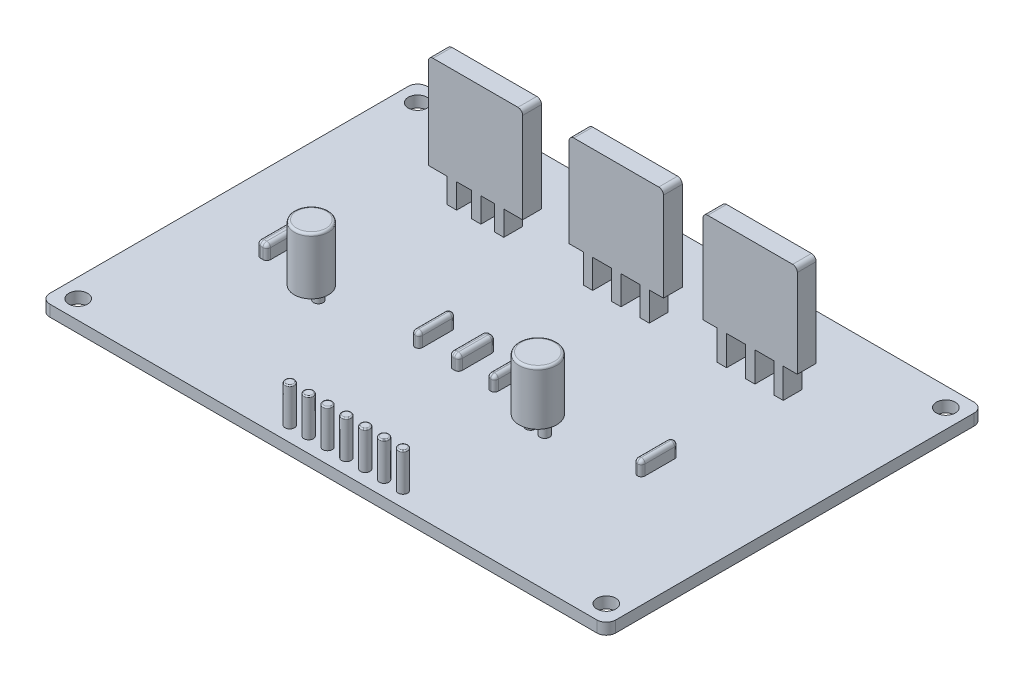
from build123d import *

# Parameters (mm, degrees)
SKETCH2_W            = 60
SKETCH2_H            = 40
BOSS_EXTRUDE1_DEPTH  = 1.2
SKETCH3_R            = 1
CUT_EXTRUDE1_DEPTH   = 2
SKETCH4_W            = 10
SKETCH4_H            = 2
BOSS_EXTRUDE2_DEPTH  = 12.69574079
SKETCH5_W            = 2
SKETCH5_H            = 2.607216684
SKETCH5_W_2          = 1.574700475
SKETCH5_W_3          = 1.425299525
CUT_EXTRUDE2_DEPTH   = 3
SKETCH6_W            = 10
SKETCH6_H            = 2
BOSS_EXTRUDE3_DEPTH  = 13
SKETCH7_W            = 1.5
SKETCH7_H            = 3.045870759
SKETCH7_W_2          = 2
CUT_EXTRUDE3_DEPTH   = 3
SKETCH8_W            = 1.5
SKETCH8_H            = 3.153243881
SKETCH8_W_2          = 2
CUT_EXTRUDE4_DEPTH   = 3
SKETCH9_R            = 0.5
BOSS_EXTRUDE5_DEPTH  = 1
SKETCH10_R           = 1.814545967
BOSS_EXTRUDE6_DEPTH  = 6
SKETCH11_R           = 0.5
BOSS_EXTRUDE7_DEPTH  = 1.5
SKETCH12_R           = 2
BOSS_EXTRUDE9_DEPTH  = 5.7
SKETCH13_R           = 0.5
BOSS_EXTRUDE10_DEPTH = 4
FILLET1_R            = 1
FILLET2_R            = 0.5
FILLET3_R            = 0.25
FILLET4_R            = 0.125
SKETCH14_W           = 0.800980935
SKETCH14_H           = 3.924518692
SKETCH14_W_2         = 1.006338104
SKETCH14_W_3         = 0.836911108
SKETCH14_W_4         = 0.805722202
SKETCH14_W_5         = 1.080198416
BOSS_EXTRUDE11_DEPTH = 1.5
FILLET5_R            = 0.4
FILLET6_R            = 0.4


with BuildPart() as part:
    # Sketch2 → Boss-Extrude1 (new body)
    with BuildSketch(Plane(origin=(0, 0, 0), x_dir=(1, 0, 0), z_dir=(0, 1, 0))):
        Rectangle(SKETCH2_W, SKETCH2_H)
    extrude(amount=BOSS_EXTRUDE1_DEPTH)

    # Sketch3 → Cut-Extrude1 (cut)
    with BuildSketch(Plane(origin=(0, 1.2, 0), x_dir=(1, 0, 0), z_dir=(0, 1, 0))):
        with Locations((-28, -18)):
            Circle(SKETCH3_R)
        with Locations((-28, 18)):
            Circle(SKETCH3_R)
        with Locations((28, 18)):
            Circle(SKETCH3_R)
        with Locations((28, -18)):
            Circle(SKETCH3_R)
    extrude(amount=-CUT_EXTRUDE1_DEPTH, mode=Mode.SUBTRACT)

    # Sketch4 → Boss-Extrude2 (add)
    with BuildSketch(Plane(origin=(0, 1.2, 0), x_dir=(1, 0, 0), z_dir=(0, 1, 0))):
        with Locations((-14.064988864, 11.195743951)):
            Rectangle(SKETCH4_W, SKETCH4_H)
    extrude(amount=BOSS_EXTRUDE2_DEPTH)

    # Sketch5 → Cut-Extrude2 (cut)
    with BuildSketch(Plane.XY.offset(-10.195743951)):
        with Locations((-18.064988864, 2.503608342)):
            Rectangle(SKETCH5_W, SKETCH5_H)
        with Locations((-10.064988864, 2.503608342)):
            Rectangle(SKETCH5_W, SKETCH5_H)
        with Locations((-15.277638626, 2.503608342)):
            Rectangle(SKETCH5_W_2, SKETCH5_H)
        with Locations((-12.777638626, 2.503608342)):
            Rectangle(SKETCH5_W_3, SKETCH5_H)
    extrude(amount=-CUT_EXTRUDE2_DEPTH, mode=Mode.SUBTRACT)

    # Sketch6 → Boss-Extrude3 (add)
    with BuildSketch(Plane(origin=(0, 1.2, 0), x_dir=(1, 0, 0), z_dir=(0, 1, 0))):
        with Locations((1.024873768, 11.033307635)):
            Rectangle(SKETCH6_W, SKETCH6_H)
        with Locations((15.221753168, 11.033307635)):
            Rectangle(SKETCH6_W, SKETCH6_H)
    extrude(amount=BOSS_EXTRUDE3_DEPTH)

    # Sketch7 → Cut-Extrude3 (cut)
    with BuildSketch(Plane.XY.offset(-10.033307635)):
        with Locations((-3.225126232, 2.72293538)):
            Rectangle(SKETCH7_W, SKETCH7_H)
        with Locations((5.274873768, 2.72293538)):
            Rectangle(SKETCH7_W, SKETCH7_H)
        with Locations((-0.475126232, 2.72293538)):
            Rectangle(SKETCH7_W_2, SKETCH7_H)
        with Locations((2.524873768, 2.72293538)):
            Rectangle(SKETCH7_W_2, SKETCH7_H)
    extrude(amount=-CUT_EXTRUDE3_DEPTH, mode=Mode.SUBTRACT)

    # Sketch8 → Cut-Extrude4 (cut)
    with BuildSketch(Plane.XY.offset(-10.033307635)):
        with Locations((10.971753168, 2.776621941)):
            Rectangle(SKETCH8_W, SKETCH8_H)
        with Locations((19.471753168, 2.776621941)):
            Rectangle(SKETCH8_W, SKETCH8_H)
        with Locations((16.721753168, 2.776621941)):
            Rectangle(SKETCH8_W_2, SKETCH8_H)
        with Locations((13.721753168, 2.776621941)):
            Rectangle(SKETCH8_W_2, SKETCH8_H)
    extrude(amount=-CUT_EXTRUDE4_DEPTH, mode=Mode.SUBTRACT)

    # Sketch9 → Boss-Extrude5 (add)
    with BuildSketch(Plane(origin=(0, 1.2, 0), x_dir=(1, 0, 0), z_dir=(0, 1, 0))):
        with Locations((-16.64570554, -5.388190515)):
            Circle(SKETCH9_R)
        with Locations((-15.14570554, -5.388190515)):
            Circle(SKETCH9_R)
    extrude(amount=BOSS_EXTRUDE5_DEPTH)

    # Sketch10 → Boss-Extrude6 (add)
    with BuildSketch(Plane(origin=(0, 2.2, 0), x_dir=(1, 0, 0), z_dir=(0, 1, 0))):
        with Locations((-15.895664673, -5.377177987)):
            Circle(SKETCH10_R)
    extrude(amount=BOSS_EXTRUDE6_DEPTH)

    # Sketch11 → Boss-Extrude7 (add)
    with BuildSketch(Plane(origin=(0, 1.2, 0), x_dir=(1, 0, 0), z_dir=(0, 1, 0))):
        with Locations((7.719899119, -5.747410751)):
            Circle(SKETCH11_R)
        with Locations((9.219899119, -5.747410751)):
            Circle(SKETCH11_R)
    extrude(amount=BOSS_EXTRUDE7_DEPTH)

    # Sketch12 → Boss-Extrude9 (add)
    with BuildSketch(Plane(origin=(0, 2.7, 0), x_dir=(1, 0, 0), z_dir=(0, 1, 0))):
        with Locations((8.453559057, -5.714453729)):
            Circle(SKETCH12_R)
    extrude(amount=BOSS_EXTRUDE9_DEPTH)

    # Sketch13 → Boss-Extrude10 (add)
    with BuildSketch(Plane(origin=(0, 1.2, 0), x_dir=(1, 0, 0), z_dir=(0, 1, 0))):
        with Locations((-5.169756881, -18.391564272)):
            Circle(SKETCH13_R)
        with Locations((-3.169756881, -18.391564272)):
            Circle(SKETCH13_R)
        with Locations((-1.169756881, -18.391564272)):
            Circle(SKETCH13_R)
        with Locations((0.830243119, -18.391564272)):
            Circle(SKETCH13_R)
        with Locations((2.830243119, -18.391564272)):
            Circle(SKETCH13_R)
        with Locations((4.830243119, -18.391564272)):
            Circle(SKETCH13_R)
        with Locations((6.830243119, -18.391564272)):
            Circle(SKETCH13_R)
    extrude(amount=BOSS_EXTRUDE10_DEPTH)

    # Fillet1
    fillet1_edges = [part.edges().sort_by_distance(p)[0] for p in [
        (-30, 0.6, -20),
        (30, 0.6, -20),
        (30, 0.6, 20),
        (-30, 0.6, 20),
    ]]
    fillet(fillet1_edges, radius=FILLET1_R)

    # Fillet2
    fillet2_edges = [part.edges().sort_by_distance(p)[0] for p in [
        (20.221753168, 14.2, -11.033307635),
        (10.221753168, 14.2, -11.033307635),
        (6.024873768, 14.2, -11.033307635),
        (-3.975126232, 14.2, -11.033307635),
        (-9.064988864, 13.89574079, -11.195743951),
        (-19.064988864, 13.89574079, -11.195743951),
    ]]
    fillet(fillet2_edges, radius=FILLET2_R)

    # Fillet3
    fillet3_edges = [part.edges().sort_by_distance(p)[0] for p in [
        (6.453559057, 8.4, 5.714453729),
        (-17.71021064, 8.2, 5.377177987),
    ]]
    fillet(fillet3_edges, radius=FILLET3_R)

    # Fillet4
    fillet4_edges = [part.edges().sort_by_distance(p)[0] for p in [
        (6.330243119, 5.2, 18.391564272),
        (4.330243119, 5.2, 18.391564272),
        (2.330243119, 5.2, 18.391564272),
        (0.330243119, 5.2, 18.391564272),
        (-1.669756881, 5.2, 18.391564272),
        (-3.669756881, 5.2, 18.391564272),
        (-5.669756881, 5.2, 18.391564272),
    ]]
    fillet(fillet4_edges, radius=FILLET4_R)

    # Sketch14 → Boss-Extrude11 (add)
    with BuildSketch(Plane(origin=(0, 1.2, 0), x_dir=(1, 0, 0), z_dir=(0, 1, 0))):
        with Locations((-5.658632568, -2.656260968)):
            Rectangle(SKETCH14_W, SKETCH14_H)
        with Locations((-1.552601189, -2.656260968)):
            Rectangle(SKETCH14_W_2, SKETCH14_H)
        with Locations((2.351814304, -2.656260968)):
            Rectangle(SKETCH14_W_3, SKETCH14_H)
        with Locations((17.927434185, -2.656260968)):
            Rectangle(SKETCH14_W_4, SKETCH14_H)
        with Locations((-21.924184268, -2.656260968)):
            Rectangle(SKETCH14_W_5, SKETCH14_H)
    extrude(amount=BOSS_EXTRUDE11_DEPTH)

    # Fillet5
    fillet5_edges = [part.edges().sort_by_distance(p)[0] for p in [
        (17.927434185, 2.7, 0.694001622),
        (18.330295286, 2.7, 2.656260968),
        (17.927434185, 2.7, 4.618520314),
        (17.524573084, 2.7, 2.656260968),
        (17.524573084, 1.95, 4.618520314),
        (18.330295286, 1.95, 4.618520314),
        (17.524573084, 1.95, 0.694001622),
        (18.330295286, 1.95, 0.694001622),
    ]]
    fillet(fillet5_edges, radius=FILLET5_R)

    # Fillet6
    fillet6_edges = [part.edges().sort_by_distance(p)[0] for p in [
        (-21.924184268, 2.7, 0.694001622),
        (-21.38408506, 2.7, 2.656260968),
        (-21.924184268, 2.7, 4.618520314),
        (-22.464283476, 2.7, 2.656260968),
        (-5.658632567, 2.7, 0.694001622),
        (-5.2581421, 2.7, 2.656260968),
        (-5.658632567, 2.7, 4.618520314),
        (-6.059123035, 2.7, 2.656260968),
        (-1.552601189, 2.7, 0.694001622),
        (-1.049432137, 2.7, 2.656260968),
        (-1.552601189, 2.7, 4.618520314),
        (-2.055770241, 2.7, 2.656260968),
        (2.351814304, 2.7, 0.694001622),
        (2.770269858, 2.7, 2.656260968),
        (2.351814304, 2.7, 4.618520314),
        (1.93335875, 2.7, 2.656260968),
        (2.770269858, 1.95, 4.618520314),
        (1.93335875, 1.95, 4.618520314),
        (2.770269858, 1.95, 0.694001622),
        (1.93335875, 1.95, 0.694001622),
        (-1.049432137, 1.95, 4.618520314),
        (-2.055770241, 1.95, 4.618520314),
        (-1.049432137, 1.95, 0.694001622),
        (-2.055770241, 1.95, 0.694001622),
        (-6.059123035, 1.95, 0.694001622),
        (-5.2581421, 1.95, 0.694001622),
        (-5.2581421, 1.95, 4.618520314),
        (-6.059123035, 1.95, 4.618520314),
        (-22.464283476, 1.95, 0.694001622),
        (-21.38408506, 1.95, 0.694001622),
        (-21.38408506, 1.95, 4.618520314),
        (-22.464283476, 1.95, 4.618520314),
    ]]
    fillet(fillet6_edges, radius=FILLET6_R)


solid = part.part
